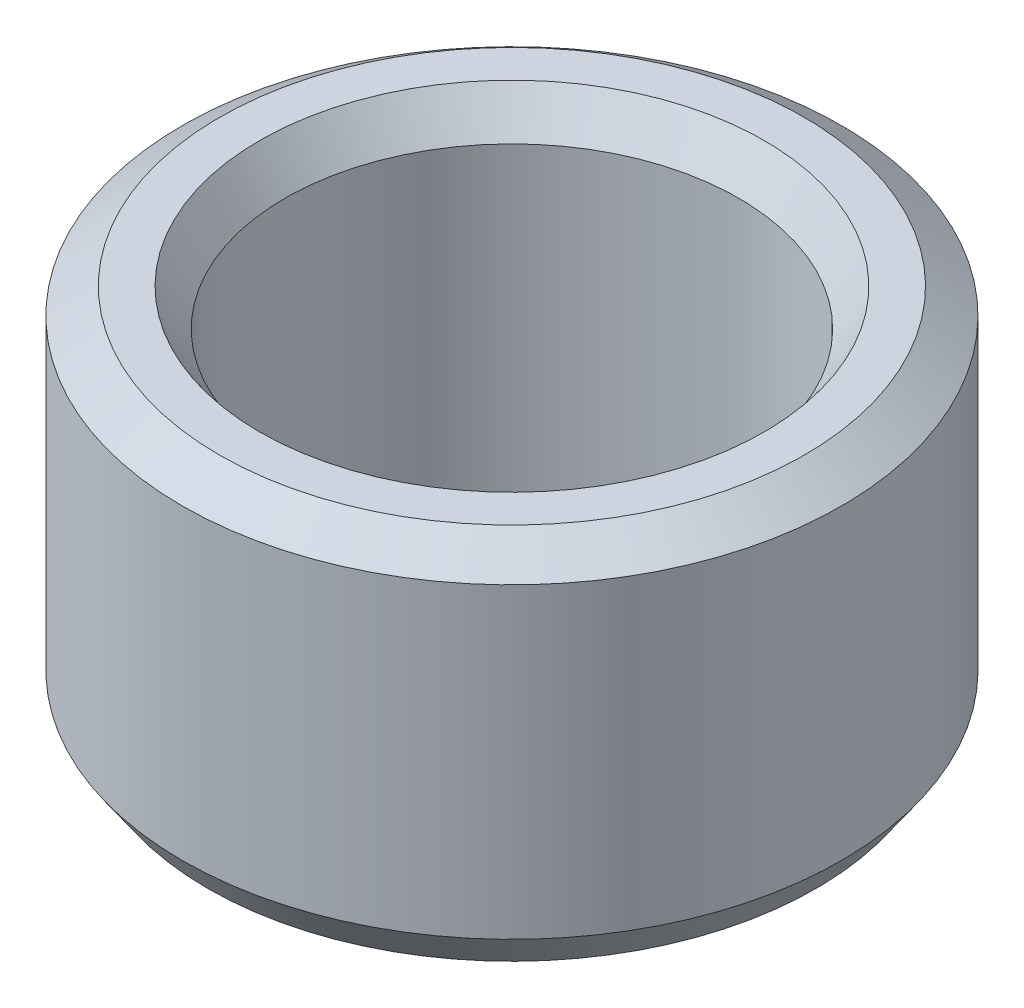
from build123d import *
from OCP.BRepFilletAPI import BRepFilletAPI_MakeChamfer

# Parameters (mm, degrees)
SKETCH1_R           = 47.5
BOSS_EXTRUDE1_DEPTH = 53.283391387
SKETCH2_R           = 32.688435652
CUT_EXTRUDE1_DEPTH  = 86.741587329
CHAMFER1_SIZE       = 3.686421925
CHAMFER1_SIZE2      = 5.347305371


with BuildPart() as part:
    # Sketch1 → Boss-Extrude1 (new body)
    with BuildSketch(Plane(origin=(0, 0, 0), x_dir=(1, 0, 0), z_dir=(0, 1, 0))):
        Circle(SKETCH1_R)
    extrude(amount=BOSS_EXTRUDE1_DEPTH)

    # Sketch2 → Cut-Extrude1 (cut, through all)
    with BuildSketch(Plane(origin=(0, 0, 0), x_dir=(1, 0, 0), z_dir=(0, 1, 0))):
        Circle(SKETCH2_R)
    extrude(amount=CUT_EXTRUDE1_DEPTH, mode=Mode.SUBTRACT)

    # Chamfer1: one chamfer whose edges measure the first distance from different faces: ONE call of the kernel's chamfer builder (chamfer() names one face for all edges)
    chamfer1_edges_1 = [part.edges().sort_by_distance(p)[0] for p in [
        (-32.688435652, 53.283391387, 0),
    ]]
    chamfer1_side_1 = [part.faces().sort_by_distance(p)[0] for p in [
        (-46.156497116, 53.283391387, 0),
    ]]
    chamfer1_edges_2 = [part.edges().sort_by_distance(p)[0] for p in [
        (-32.688435652, 0, 0),
    ]]
    chamfer1_side_2 = [part.faces().sort_by_distance(p)[0] for p in [
        (-32.688435652, 26.641695694, 0),
    ]]
    chamfer1_edges_3 = [part.edges().sort_by_distance(p)[0] for p in [
        (-47.5, 0, 0),
    ]]
    chamfer1_side_3 = [part.faces().sort_by_distance(p)[0] for p in [
        (-46.156497116, 0, 0),
    ]]
    chamfer1_edges_4 = [part.edges().sort_by_distance(p)[0] for p in [
        (-47.5, 53.283391387, 0),
    ]]
    chamfer1_side_4 = [part.faces().sort_by_distance(p)[0] for p in [
        (-47.5, 26.641695694, 0),
    ]]
    chamfer1 = BRepFilletAPI_MakeChamfer(part.part.solid().wrapped)
    for e in chamfer1_edges_1:
        chamfer1.Add(CHAMFER1_SIZE, CHAMFER1_SIZE2, e.wrapped, chamfer1_side_1[0].wrapped)  # the first distance lies on this face
    for e in chamfer1_edges_2:
        chamfer1.Add(CHAMFER1_SIZE, CHAMFER1_SIZE2, e.wrapped, chamfer1_side_2[0].wrapped)  # the first distance lies on this face
    for e in chamfer1_edges_3:
        chamfer1.Add(CHAMFER1_SIZE, CHAMFER1_SIZE2, e.wrapped, chamfer1_side_3[0].wrapped)  # the first distance lies on this face
    for e in chamfer1_edges_4:
        chamfer1.Add(CHAMFER1_SIZE, CHAMFER1_SIZE2, e.wrapped, chamfer1_side_4[0].wrapped)  # the first distance lies on this face
    add(Compound.cast(chamfer1.Shape()), mode=Mode.REPLACE)


solid = part.part
